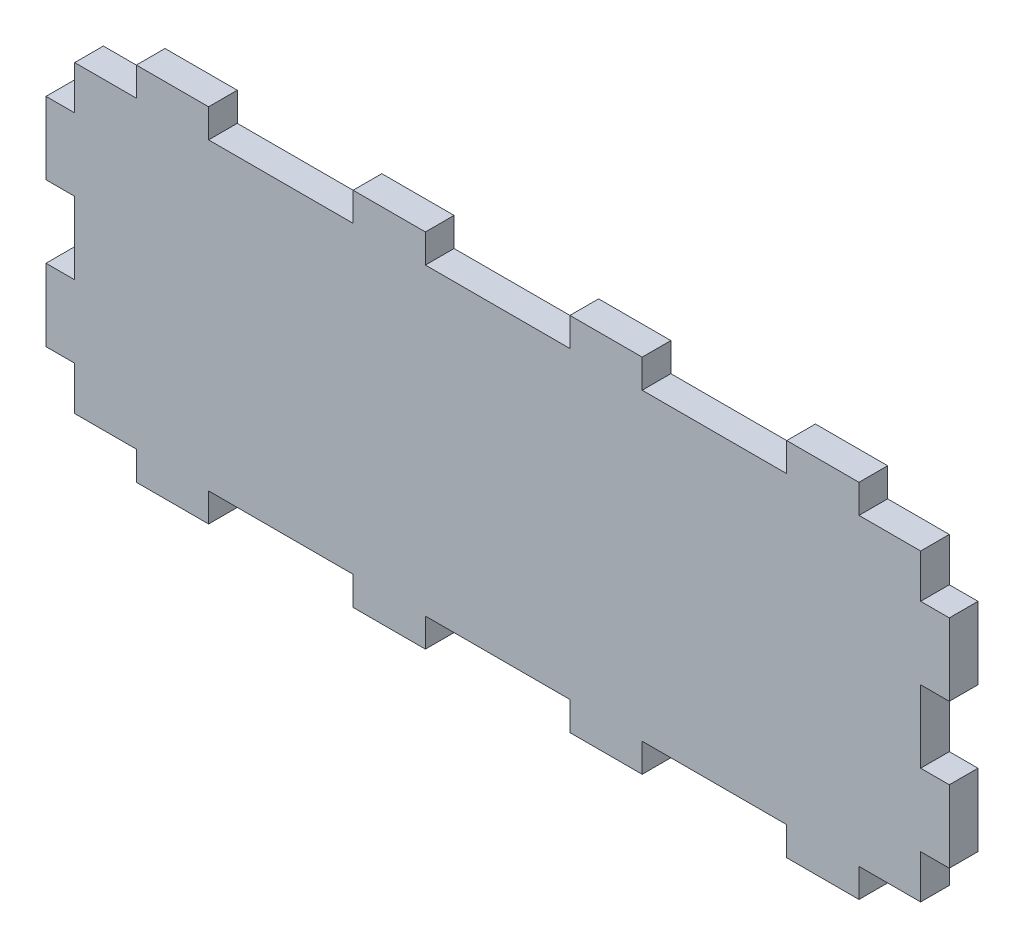
from build123d import *

# Parameters (mm, degrees)
SKETCH1_W           = 100
SKETCH1_H           = 40
BOSS_EXTRUDE1_DEPTH = 3.175
CUT_EXTRUDE1_REACH  = 109.75
SKETCH2_W           = 10
SKETCH2_H           = 3.175
SKETCH2_W_2         = 16
CUT_EXTRUDE2_REACH  = 109.75
SKETCH3_W           = 3.175
SKETCH3_H           = 4.825
SKETCH3_H_2         = 8


with BuildPart() as part:
    # Sketch1 → Boss-Extrude1 (new body)
    with BuildSketch(Plane.XY):
        with Locations((50, -20)):
            Rectangle(SKETCH1_W, SKETCH1_H)
    extrude(amount=BOSS_EXTRUDE1_DEPTH)

    # Sketch2 → Cut-Extrude1 (cut, up to next)
    with BuildSketch(Plane.XY.offset(3.175), mode=Mode.PRIVATE) as cut_extrude1_sk1:
        with Locations((5, -38.4125)):
            Rectangle(SKETCH2_W, SKETCH2_H)
    cut_extrude1_tool1 = extrude(cut_extrude1_sk1.sketch, amount=-CUT_EXTRUDE1_REACH, mode=Mode.PRIVATE) & part.part
    # Sketch2 → Cut-Extrude1 (cut, up to next)
    with BuildSketch(Plane.XY.offset(3.175), mode=Mode.PRIVATE) as cut_extrude1_sk2:
        with Locations((5, -1.5875)):
            Rectangle(SKETCH2_W, SKETCH2_H)
    cut_extrude1_tool2 = extrude(cut_extrude1_sk2.sketch, amount=-CUT_EXTRUDE1_REACH, mode=Mode.PRIVATE) & part.part
    # Sketch2 → Cut-Extrude1 (cut, up to next)
    with BuildSketch(Plane.XY.offset(3.175), mode=Mode.PRIVATE) as cut_extrude1_sk3:
        with Locations((50, -38.4125)):
            Rectangle(SKETCH2_W_2, SKETCH2_H)
    cut_extrude1_tool3 = extrude(cut_extrude1_sk3.sketch, amount=-CUT_EXTRUDE1_REACH, mode=Mode.PRIVATE) & part.part
    # Sketch2 → Cut-Extrude1 (cut, up to next)
    with BuildSketch(Plane.XY.offset(3.175), mode=Mode.PRIVATE) as cut_extrude1_sk4:
        with Locations((74, -38.4125)):
            Rectangle(SKETCH2_W_2, SKETCH2_H)
    cut_extrude1_tool4 = extrude(cut_extrude1_sk4.sketch, amount=-CUT_EXTRUDE1_REACH, mode=Mode.PRIVATE) & part.part
    # Sketch2 → Cut-Extrude1 (cut, up to next)
    with BuildSketch(Plane.XY.offset(3.175), mode=Mode.PRIVATE) as cut_extrude1_sk5:
        with Locations((95, -38.4125)):
            Rectangle(SKETCH2_W, SKETCH2_H)
    cut_extrude1_tool5 = extrude(cut_extrude1_sk5.sketch, amount=-CUT_EXTRUDE1_REACH, mode=Mode.PRIVATE) & part.part
    # Sketch2 → Cut-Extrude1 (cut, up to next)
    with BuildSketch(Plane.XY.offset(3.175), mode=Mode.PRIVATE) as cut_extrude1_sk6:
        with Locations((26, -38.4125)):
            Rectangle(SKETCH2_W_2, SKETCH2_H)
    cut_extrude1_tool6 = extrude(cut_extrude1_sk6.sketch, amount=-CUT_EXTRUDE1_REACH, mode=Mode.PRIVATE) & part.part
    # Sketch2 → Cut-Extrude1 (cut, up to next)
    with BuildSketch(Plane.XY.offset(3.175), mode=Mode.PRIVATE) as cut_extrude1_sk7:
        with Locations((26, -1.5875)):
            Rectangle(SKETCH2_W_2, SKETCH2_H)
    cut_extrude1_tool7 = extrude(cut_extrude1_sk7.sketch, amount=-CUT_EXTRUDE1_REACH, mode=Mode.PRIVATE) & part.part
    # Sketch2 → Cut-Extrude1 (cut, up to next)
    with BuildSketch(Plane.XY.offset(3.175), mode=Mode.PRIVATE) as cut_extrude1_sk8:
        with Locations((95, -1.5875)):
            Rectangle(SKETCH2_W, SKETCH2_H)
    cut_extrude1_tool8 = extrude(cut_extrude1_sk8.sketch, amount=-CUT_EXTRUDE1_REACH, mode=Mode.PRIVATE) & part.part
    # Sketch2 → Cut-Extrude1 (cut, up to next)
    with BuildSketch(Plane.XY.offset(3.175), mode=Mode.PRIVATE) as cut_extrude1_sk9:
        with Locations((50, -1.5875)):
            Rectangle(SKETCH2_W_2, SKETCH2_H)
    cut_extrude1_tool9 = extrude(cut_extrude1_sk9.sketch, amount=-CUT_EXTRUDE1_REACH, mode=Mode.PRIVATE) & part.part
    # Sketch2 → Cut-Extrude1 (cut, up to next)
    with BuildSketch(Plane.XY.offset(3.175), mode=Mode.PRIVATE) as cut_extrude1_sk10:
        with Locations((74, -1.5875)):
            Rectangle(SKETCH2_W_2, SKETCH2_H)
    cut_extrude1_tool10 = extrude(cut_extrude1_sk10.sketch, amount=-CUT_EXTRUDE1_REACH, mode=Mode.PRIVATE) & part.part
    add(cut_extrude1_tool1.solids().sort_by_distance((5, -38.4125, 3.175))[0], mode=Mode.SUBTRACT)
    add(cut_extrude1_tool2.solids().sort_by_distance((5, -1.5875, 3.175))[0], mode=Mode.SUBTRACT)
    add(cut_extrude1_tool3.solids().sort_by_distance((50, -38.4125, 3.175))[0], mode=Mode.SUBTRACT)
    add(cut_extrude1_tool4.solids().sort_by_distance((74, -38.4125, 3.175))[0], mode=Mode.SUBTRACT)
    add(cut_extrude1_tool5.solids().sort_by_distance((95, -38.4125, 3.175))[0], mode=Mode.SUBTRACT)
    add(cut_extrude1_tool6.solids().sort_by_distance((26, -38.4125, 3.175))[0], mode=Mode.SUBTRACT)
    add(cut_extrude1_tool7.solids().sort_by_distance((26, -1.5875, 3.175))[0], mode=Mode.SUBTRACT)
    add(cut_extrude1_tool8.solids().sort_by_distance((95, -1.5875, 3.175))[0], mode=Mode.SUBTRACT)
    add(cut_extrude1_tool9.solids().sort_by_distance((50, -1.5875, 3.175))[0], mode=Mode.SUBTRACT)
    add(cut_extrude1_tool10.solids().sort_by_distance((74, -1.5875, 3.175))[0], mode=Mode.SUBTRACT)

    # Sketch3 → Cut-Extrude2 (cut, up to next)
    with BuildSketch(Plane.XY.offset(3.175), mode=Mode.PRIVATE) as cut_extrude2_sk1:
        with Locations((1.5875, -34.4125)):
            Rectangle(SKETCH3_W, SKETCH3_H)
    cut_extrude2_tool1 = extrude(cut_extrude2_sk1.sketch, amount=-CUT_EXTRUDE2_REACH, mode=Mode.PRIVATE) & part.part
    # Sketch3 → Cut-Extrude2 (cut, up to next)
    with BuildSketch(Plane.XY.offset(3.175), mode=Mode.PRIVATE) as cut_extrude2_sk2:
        with Locations((1.5875, -20)):
            Rectangle(SKETCH3_W, SKETCH3_H_2)
    cut_extrude2_tool2 = extrude(cut_extrude2_sk2.sketch, amount=-CUT_EXTRUDE2_REACH, mode=Mode.PRIVATE) & part.part
    # Sketch3 → Cut-Extrude2 (cut, up to next)
    with BuildSketch(Plane.XY.offset(3.175), mode=Mode.PRIVATE) as cut_extrude2_sk3:
        with Locations((1.5875, -5.5875)):
            Rectangle(SKETCH3_W, SKETCH3_H)
    cut_extrude2_tool3 = extrude(cut_extrude2_sk3.sketch, amount=-CUT_EXTRUDE2_REACH, mode=Mode.PRIVATE) & part.part
    # Sketch3 → Cut-Extrude2 (cut, up to next)
    with BuildSketch(Plane.XY.offset(3.175), mode=Mode.PRIVATE) as cut_extrude2_sk4:
        with Locations((98.4125, -20)):
            Rectangle(SKETCH3_W, SKETCH3_H_2)
    cut_extrude2_tool4 = extrude(cut_extrude2_sk4.sketch, amount=-CUT_EXTRUDE2_REACH, mode=Mode.PRIVATE) & part.part
    # Sketch3 → Cut-Extrude2 (cut, up to next)
    with BuildSketch(Plane.XY.offset(3.175), mode=Mode.PRIVATE) as cut_extrude2_sk5:
        with Locations((98.4125, -34.4125)):
            Rectangle(SKETCH3_W, SKETCH3_H)
    cut_extrude2_tool5 = extrude(cut_extrude2_sk5.sketch, amount=-CUT_EXTRUDE2_REACH, mode=Mode.PRIVATE) & part.part
    # Sketch3 → Cut-Extrude2 (cut, up to next)
    with BuildSketch(Plane.XY.offset(3.175), mode=Mode.PRIVATE) as cut_extrude2_sk6:
        with Locations((98.4125, -5.5875)):
            Rectangle(SKETCH3_W, SKETCH3_H)
    cut_extrude2_tool6 = extrude(cut_extrude2_sk6.sketch, amount=-CUT_EXTRUDE2_REACH, mode=Mode.PRIVATE) & part.part
    add(cut_extrude2_tool1.solids().sort_by_distance((1.5875, -34.4125, 3.175))[0], mode=Mode.SUBTRACT)
    add(cut_extrude2_tool2.solids().sort_by_distance((1.5875, -20, 3.175))[0], mode=Mode.SUBTRACT)
    add(cut_extrude2_tool3.solids().sort_by_distance((1.5875, -5.5875, 3.175))[0], mode=Mode.SUBTRACT)
    add(cut_extrude2_tool4.solids().sort_by_distance((98.4125, -20, 3.175))[0], mode=Mode.SUBTRACT)
    add(cut_extrude2_tool5.solids().sort_by_distance((98.4125, -34.4125, 3.175))[0], mode=Mode.SUBTRACT)
    add(cut_extrude2_tool6.solids().sort_by_distance((98.4125, -5.5875, 3.175))[0], mode=Mode.SUBTRACT)


solid = part.part
